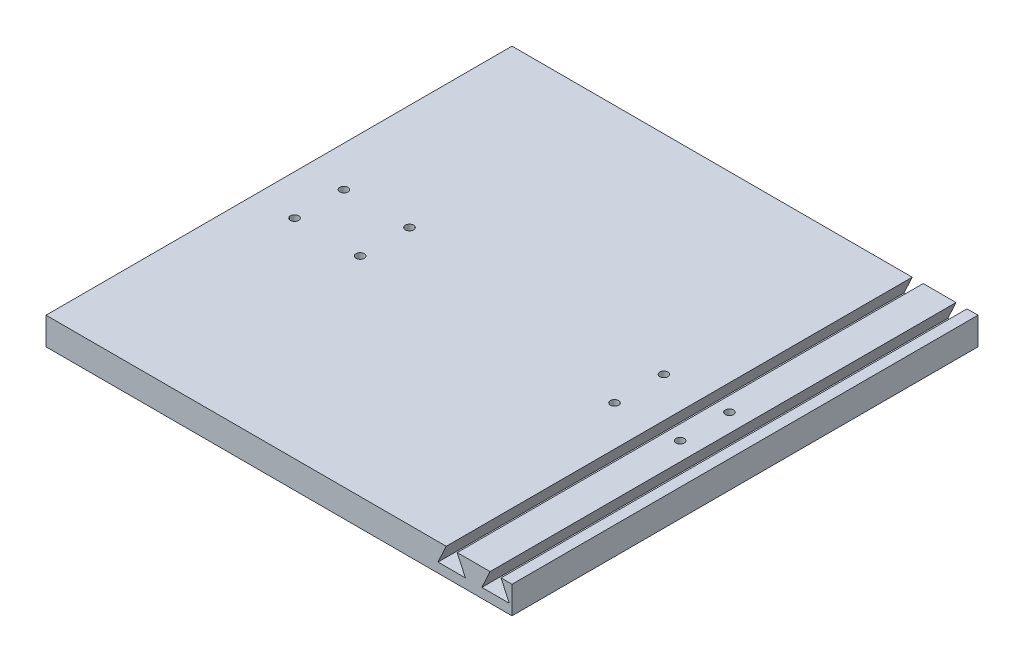
from build123d import *

# Parameters (mm, degrees)
SKETCH2_W               = 170
SKETCH2_H               = 170
BOSS_EXTRUDE1_DEPTH     = 10
CUT_EXTRUDE2_DEPTH      = 121.623380818
CUT_EXTRUDE2_DEPTH_BACK = 121.623380818
SKETCH4_R               = 1.5
CUT_EXTRUDE5_DEPTH      = 200


with BuildPart() as part:
    # Sketch2 → Boss-Extrude1 (new body)
    with BuildSketch(Plane(origin=(0, 0, 0), x_dir=(1, 0, 0), z_dir=(0, 1, 0))):
        Rectangle(SKETCH2_W, SKETCH2_H)
    extrude(amount=BOSS_EXTRUDE1_DEPTH)

    # Sketch4 → Cut-Extrude2 (cut, two sides: drawn at the far end of the back side and taken through both)
    with BuildSketch(Plane(origin=(0, 0, 0), x_dir=(-1, 0, 0), z_dir=(0, -1, 0)).offset(-CUT_EXTRUDE2_DEPTH_BACK)):
        with Locations((-70.33, -9)):
            Circle(SKETCH4_R)
        with Locations((-70.33, 9)):
            Circle(SKETCH4_R)
        with Locations((70.33, 9)):
            Circle(SKETCH4_R)
        with Locations((70.33, -9)):
            Circle(SKETCH4_R)
        with Locations((46.4, 9)):
            Circle(SKETCH4_R)
        with Locations((46.4, -9)):
            Circle(SKETCH4_R)
        with Locations((-46.4, -9)):
            Circle(SKETCH4_R)
        with Locations((-46.4, 9)):
            Circle(SKETCH4_R)
    extrude(amount=CUT_EXTRUDE2_DEPTH + CUT_EXTRUDE2_DEPTH_BACK, mode=Mode.SUBTRACT)

    # Sketch5 → Cut-Extrude5 (cut)
    with BuildSketch(Plane(origin=(0, 0, -85), x_dir=(-1, 0, 0), z_dir=(0, 0, -1))):
        Polygon((-58, 3.5), (-61, 10), (-65.001176076, 10), (-68, 3.5), align=None)
        Polygon((-84, 3.5), (-74, 3.5), (-76.998823924, 10), (-81, 10), align=None)
    extrude(amount=-CUT_EXTRUDE5_DEPTH, mode=Mode.SUBTRACT)


solid = part.part
